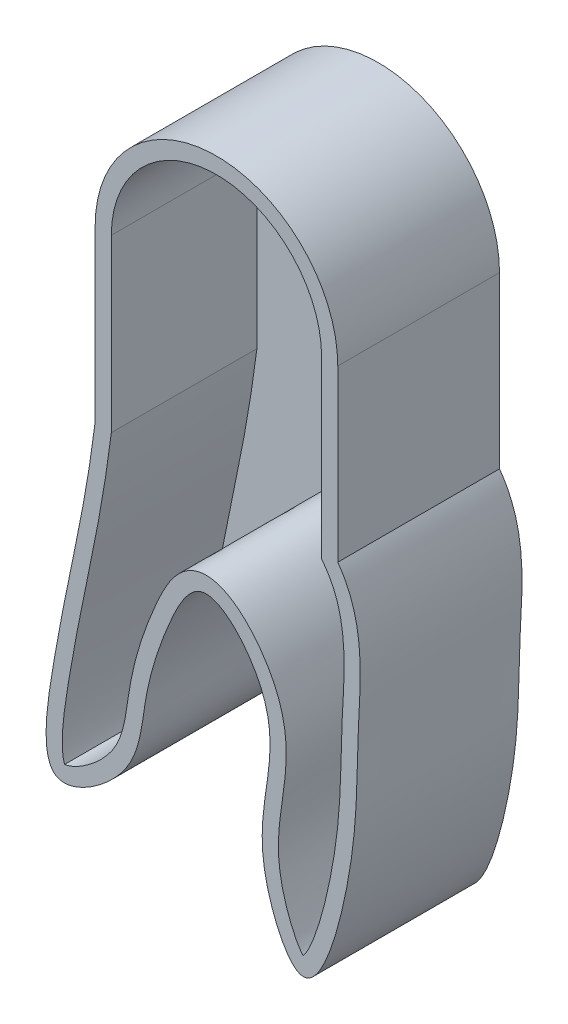
from build123d import *

# Parameters (mm, degrees)
EXTRUDE_1_DEPTH     = 10
SHELL_START         = 1
SHELL_1_DEPTH       = 9
SKETCH_2_R          = 2.5
CUT_EXTRUDE_1_DEPTH = 10


# Read off the part's stored shape, not the designer's step: 抽壳1
with BuildPart() as part:
    # 草图1 → 凸台-拉伸1 (new body)
    with BuildSketch(Plane.XY):
        with BuildLine():
            Line((7.5, 0), (7.5, -10.504729681))
            add(Edge.make_bspline(
                [(-7.5, -10.504729681), (-8.237692866, -16.341939492), (-9.423346825, -19.848680279), (-11.310421688, -32.767135896), (-4.816451011, -28.41808076), (-4.526845561, -23.67231359), (-3.413911229, -19.891624537), (-0.899508814, -14.646125223), (3.169720617, -19.182232615), (3.507472939, -23.903840986), (2.071045178, -28.290989918), (5.768685697, -36.949250656), (8.858203176, -25.581650207), (8.533740437, -19.156909422), (9.28913872, -12.950230698), (7.5, -10.504729681)],
                knots=[0, 0, 0, 0, 0.178620639, 0.24958107, 0.30893363, 0.361521367, 0.424026747, 0.465995345, 0.525846151, 0.56862507, 0.643666161, 0.705814194, 0.797942259, 0.893550311, 1, 1, 1, 1], degree=3))
            Line((-7.5, -10.504729681), (-7.5, 0))
            ThreePointArc((-7.5, 0), (0, 7.5), (7.5, 0))
        make_face()
    extrude(amount=EXTRUDE_1_DEPTH)

    # 抽壳1 outline → 抽壳1 (cut)
    with BuildSketch(Plane.XY.offset(SHELL_START)):
        with BuildLine():
            add(Edge.make_bspline(
                [(-9.383902892, -29.773691739), (-9.345005647, -29.770678871), (-9.294096014, -29.764011787), (-9.232413092, -29.75228086), (-9.161442536, -29.734674803), (-9.082569787, -29.710864184), (-8.996984959, -29.680774768), (-8.905709805, -29.644461518), (-8.80964954, -29.602073611), (-8.709620176, -29.553837703), (-8.606349618, -29.500018036), (-8.500481996, -29.440875358), (-8.392613639, -29.376679242), (-8.283339862, -29.307767597), (-8.037895571, -29.144369435), (-7.901279346, -29.047641155), (-7.764320472, -28.944820456), (-7.627938824, -28.836501751), (-7.493001987, -28.723294857), (-7.360340411, -28.605823618), (-7.230758927, -28.484727209), (-7.105044639, -28.360664102), (-6.983971186, -28.234318731), (-6.868299364, -28.106410797), (-6.758774133, -27.977707283), (-6.656117981, -27.849037118), (-6.561020663, -27.721308531), (-6.452401472, -27.564084202), (-6.431243879, -27.532839642), (-6.410089915, -27.500973477), (-6.390201162, -27.470364535), (-6.369240622, -27.437549386), (-6.350653598, -27.40766841), (-6.330273554, -27.374510326), (-6.312163421, -27.344160978), (-6.293091232, -27.311784606), (-6.275097209, -27.280452015), (-6.25715015, -27.248620075), (-6.239634779, -27.216875498), (-6.222435613, -27.185051245), (-6.188695791, -27.121296643), (-6.172153309, -27.089363709), (-6.155931658, -27.057371928), (-6.140024373, -27.025318155), (-6.124425119, -26.993199312), (-6.109127692, -26.961012393), (-6.094126017, -26.928754451), (-6.079414152, -26.896422619), (-6.064986284, -26.864014085), (-6.050836733, -26.831526116), (-6.036959947, -26.79895604), (-6.023350505, -26.766301256), (-6.01000312, -26.73355923), (-5.970731652, -26.635064025), (-5.945577899, -26.569042312), (-5.921409712, -26.502642812), (-5.898186907, -26.43584796), (-5.875870552, -26.36864211), (-5.854422748, -26.301011487), (-5.833806409, -26.232944124), (-5.813985034, -26.164429809), (-5.794922493, -26.095460032), (-5.776582804, -26.026027924), (-5.758929908, -25.956128206), (-5.741927452, -25.88575713), (-5.725538566, -25.814912427), (-5.693912717, -25.67227407), (-5.678675798, -25.600480123), (-5.663977649, -25.528210366), (-5.649780354, -25.455464859), (-5.636045251, -25.38224466), (-5.622732878, -25.308551707), (-5.60980291, -25.23438872), (-5.5972141, -25.15975908), (-5.584924221, -25.084666732), (-5.572890005, -25.009116066), (-5.561067085, -24.933111816), (-5.549409932, -24.856658944), (-5.537871799, -24.779762537), (-5.520671092, -24.663760272), (-5.514955281, -24.624983267), (-5.509251248, -24.586097337), (-5.503552931, -24.54710315), (-5.497854193, -24.508001381), (-5.492148815, -24.468792712), (-5.486430501, -24.429477833), (-5.480692873, -24.390057442), (-5.474929476, -24.350532245), (-5.469133775, -24.310902953), (-5.463299156, -24.27117029), (-5.457418926, -24.231334983), (-5.451486313, -24.191397769), (-5.44249854, -24.131340201), (-5.439487863, -24.111295711), (-5.436461547, -24.091226019), (-5.433418704, -24.071131224), (-5.43035845, -24.051011426), (-5.427279898, -24.030866722), (-5.424182162, -24.010697215), (-5.421064355, -23.990503), (-5.417925591, -23.970284179), (-5.414764985, -23.95004085), (-5.41158165, -23.929773112), (-5.408374699, -23.909481065), (-5.405143247, -23.889164808), (-5.398629567, -23.848484071), (-5.395345492, -23.828109009), (-5.392049369, -23.807798451), (-5.388728263, -23.78746793), (-5.385384599, -23.767133751), (-5.382022954, -23.746826151), (-5.378641774, -23.726535083), (-5.37523779, -23.706239326), (-5.371811713, -23.685943837), (-5.368366503, -23.66566832), (-5.364901329, -23.645407505), (-5.361412466, -23.625137129), (-5.357904059, -23.60488472), (-5.297895039, -23.260680114), (-5.235993395, -22.938607333), (-5.168419236, -22.617757174), (-5.094940308, -22.297484084), (-5.015339578, -21.977147889), (-4.929412628, -21.656104625), (-4.836964928, -21.333699118), (-4.737808968, -21.009259329), (-4.631761276, -20.682092469), (-4.518639292, -20.351482853), (-4.39825813, -20.016691539), (-4.270427199, -19.676957713), (-4.134946699, -19.331501836), (-3.982645074, -18.957532356), (-3.973654261, -18.935506089), (-3.964645341, -18.913482147), (-3.955538384, -18.891282487), (-3.946634022, -18.869581388), (-3.937114369, -18.846530764), (-3.928668233, -18.825973389), (-3.918580717, -18.801688835), (-3.910281691, -18.78158915), (-3.900379875, -18.757797004), (-3.891440241, -18.736314183), (-3.882060977, -18.713832222), (-3.872725684, -18.691505121), (-3.853948533, -18.64669963), (-3.844515734, -18.624242926), (-3.835038443, -18.601734185), (-3.825516394, -18.579175327), (-3.81594932, -18.556568275), (-3.806336953, -18.533914948), (-3.796679026, -18.511217269), (-3.786975272, -18.488477157), (-3.777225424, -18.465696536), (-3.767429215, -18.442877324), (-3.757586377, -18.420021445), (-3.747696644, -18.397130819), (-3.737759748, -18.374207367), (-3.707806769, -18.305344296), (-3.687647827, -18.259311449), (-3.66729615, -18.213169329), (-3.646749073, -18.166932613), (-3.626003711, -18.120615807), (-3.605056961, -18.074233236), (-3.583905503, -18.027799054), (-3.562545795, -17.981327229), (-3.540974079, -17.934831564), (-3.519186377, -17.888325675), (-3.497178492, -17.841823008), (-3.474946008, -17.795336828), (-3.452484292, -17.748880227), (-3.384396889, -17.6096379), (-3.338068252, -17.516980214), (-3.290762494, -17.424595066), (-3.242434456, -17.33258304), (-3.193033354, -17.241042282), (-3.142501947, -17.150067906), (-3.090775426, -17.059751792), (-3.037780044, -16.970182817), (-2.983431451, -16.881447473), (-2.927632778, -16.793630914), (-2.870272427, -16.706818402), (-2.811221599, -16.621097172), (-2.750331546, -16.536558699), (-2.624529543, -16.370044069), (-2.559618097, -16.288071928), (-2.492523903, -16.207475669), (-2.423052695, -16.128370792), (-2.350986672, -16.050886443), (-2.276081482, -15.975167102), (-2.198064208, -15.901383718), (-2.116634804, -15.829750926), (-2.031473402, -15.760546947), (-1.942255958, -15.694132813), (-1.848680637, -15.630967522), (-1.750507422, -15.57161575), (-1.647613345, -15.516744735), (-1.526622365, -15.46090224), (-1.513106192, -15.454779207), (-1.499517389, -15.448739326), (-1.485856107, -15.442784067), (-1.472122548, -15.436914909), (-1.458316959, -15.431133341), (-1.444439639, -15.425440857), (-1.430490933, -15.41983896), (-1.416471239, -15.414329161), (-1.402380999, -15.408912981), (-1.388220709, -15.403591944), (-1.373990908, -15.398367588), (-1.35969219, -15.393241455), (-1.338141696, -15.385701916), (-1.330941094, -15.38321368), (-1.323723488, -15.380750576), (-1.316488978, -15.378312794), (-1.309237665, -15.375900523), (-1.301969648, -15.373513955), (-1.294685029, -15.371153276), (-1.287383906, -15.368818678), (-1.28006638, -15.36651035), (-1.272732552, -15.364228482), (-1.265382522, -15.361973262), (-1.25801639, -15.359744882), (-1.250634255, -15.357543529), (-1.235838183, -15.35319526), (-1.228425099, -15.351048626), (-1.221000436, -15.348930241), (-1.213523977, -15.346829838), (-1.206090361, -15.344773553), (-1.19866789, -15.342752119), (-1.191202271, -15.340750402), (-1.18372649, -15.338777744), (-1.176282499, -15.336845772), (-1.168831324, -15.334943362), (-1.161340716, -15.333061464), (-1.153884058, -15.331220661), (-1.146408026, -15.329405813), (-1.109028632, -15.320488565), (-1.079080142, -15.313844249), (-1.049099169, -15.307687187), (-1.019097784, -15.302014682), (-0.989087634, -15.296823567), (-0.959079945, -15.292110202), (-0.92908552, -15.287870481), (-0.899114742, -15.284099825), (-0.869177571, -15.280793189), (-0.839283544, -15.277945054), (-0.809441777, -15.275549434), (-0.779660965, -15.273599871), (-0.749949379, -15.272089438), (-0.661045852, -15.26885334), (-0.60208361, -15.268424744), (-0.543489175, -15.26966956), (-0.4853144, -15.272528342), (-0.427602375, -15.276939146), (-0.370387898, -15.282838886), (-0.313698015, -15.290164505), (-0.257552629, -15.298853954), (-0.201965177, -15.308846976), (-0.14694337, -15.320085705), (-0.092490005, -15.33251507), (-0.038603842, -15.34608301), (0.014719454, -15.360740494), (0.278553682, -15.439244799), (0.480721416, -15.518747802), (0.674426214, -15.611979803), (0.860789169, -15.716826221), (1.04090182, -15.831865529), (1.215602521, -15.956115143), (1.385473291, -16.08881583), (1.550899578, -16.229303334), (1.712120427, -16.376960115), (1.869254299, -16.531209674), (2.022316338, -16.691510693), (2.171246133, -16.85732829), (2.315941082, -17.028105047), (2.526388235, -17.290935039), (2.595438628, -17.379654904), (2.663370193, -17.469418973), (2.730160357, -17.560161705), (2.795784301, -17.651817857), (2.860215121, -17.744322665), (2.923423982, -17.837612021), (2.985380283, -17.931622656), (3.046051809, -18.02629231), (3.10540489, -18.121559921), (3.163404567, -18.217365798), (3.220014738, -18.313651799), (3.275198329, -18.410361514), (3.355776998, -18.555979899), (3.382273154, -18.604618526), (3.40837042, -18.653275177), (3.43423063, -18.702346213), (3.459259036, -18.75040377), (3.484958985, -18.801064441), (3.508389778, -18.847298414), (3.534016121, -18.899747384), (3.55643196, -18.945606725), (3.58082973, -18.997113259), (3.603248377, -19.045017187), (3.626001781, -19.09467686), (3.648111033, -19.143878136), (3.691455376, -19.242264306), (3.712673027, -19.291411264), (3.733438937, -19.340510956), (3.753755939, -19.389562204), (3.773626916, -19.438563791), (3.793054807, -19.487514459), (3.812042602, -19.53641291), (3.830593344, -19.585257805), (3.848710128, -19.634047769), (3.866396102, -19.682781382), (3.883654467, -19.731457187), (3.900488477, -19.780073688), (3.916901438, -19.828629345), (3.996877791, -20.071095533), (4.054177293, -20.264069894), (4.10500908, -20.45594835), (4.149605674, -20.646626058), (4.188217429, -20.835996471), (4.221111375, -21.023956282), (4.248569687, -21.210409476), (4.270887814, -21.395270501), (4.288372248, -21.578466548), (4.301337937, -21.759938954), (4.310105347, -21.939643705), (4.314997169, -22.117551066), (4.316334669, -22.293644318), (4.31395844, -22.511485935), (4.313280843, -22.554940492), (4.312405883, -22.598281211), (4.311338533, -22.641508056), (4.310083747, -22.68462103), (4.308646464, -22.727620166), (4.307031601, -22.77050554), (4.305244062, -22.813277259), (4.30328873, -22.855935468), (4.301170472, -22.898480348), (4.298894138, -22.940912114), (4.296464558, -22.98323102), (4.293886547, -23.025437354), (4.288443255, -23.109625528), (4.285577681, -23.151613067), (4.282571988, -23.19350066), (4.279430271, -23.235289907), (4.276156715, -23.276980641), (4.272755489, -23.318572767), (4.269230695, -23.360067016), (4.265586373, -23.401464931), (4.261826522, -23.442768408), (4.257955139, -23.483979085), (4.253976242, -23.525097922), (4.249893864, -23.566125264), (4.245712004, -23.607061712), (4.232879503, -23.729606913), (4.223942015, -23.81094887), (4.214653615, -23.891946405), (4.205045453, -23.972610191), (4.195148263, -24.052951143), (4.184992354, -24.132980427), (4.174607617, -24.212709451), (4.164023521, -24.292149874), (4.153269116, -24.371313598), (4.142373028, -24.450212774), (4.131363466, -24.528859797), (4.120268216, -24.607267311), (4.109114642, -24.685448206), (4.07555979, -24.919350439), (4.053063483, -25.074429687), (4.030657439, -25.228757936), (4.008550654, -25.38244116), (3.986945063, -25.535587143), (3.966036149, -25.688305874), (3.946013552, -25.840709964), (3.927061676, -25.992915033), (3.909360301, -26.145040137), (3.893085189, -26.297208148), (3.878408695, -26.449546178), (3.865500373, -26.602185969), (3.85452759, -26.75526431), (3.841220398, -26.98575299), (3.837310611, -27.062727711), (3.833947262, -27.139865492), (3.831151, -27.217184551), (3.828942624, -27.294703423), (3.827343088, -27.372440967), (3.826373496, -27.450416352), (3.826055107, -27.528649076), (3.826409331, -27.607158945), (3.827457731, -27.685966093), (3.829222023, -27.765090968), (3.831724076, -27.844554337), (3.834985909, -27.924377287), (3.841051592, -28.04468319), (3.843269079, -28.084880349), (3.845684971, -28.125175364), (3.848302103, -28.165570907), (3.851123336, -28.20606966), (3.854151551, -28.246674308), (3.857389656, -28.287387552), (3.86084058, -28.328212089), (3.864507276, -28.369150636), (3.868392721, -28.410205909), (3.872499917, -28.451380637), (3.876831886, -28.492677552), (3.881391678, -28.534099399), (3.888577704, -28.596423691), (3.891030753, -28.617230373), (3.893541903, -28.638069315), (3.896111546, -28.658940858), (3.898740077, -28.679845344), (3.901427889, -28.700783115), (3.904175376, -28.721754513), (3.906982932, -28.74275988), (3.909850949, -28.763799557), (3.912779822, -28.784873886), (3.915769945, -28.80598321), (3.91882171, -28.827127869), (3.921935513, -28.848308206), (3.926699861, -28.880132741), (3.928303429, -28.890748928), (3.929923068, -28.901376692), (3.931558299, -28.912012807), (3.93320897, -28.922656055), (3.934875393, -28.933308079), (3.936557956, -28.943971002), (3.938256738, -28.954645082), (3.939971448, -28.965328251), (3.941701718, -28.976017961), (3.943447624, -28.986714332), (3.94521, -28.997422183), (3.946989934, -29.008148087), (3.950583213, -29.029626252), (3.952396686, -29.040379176), (3.95422695, -29.051145736), (3.956073966, -29.061925726), (3.95793769, -29.072718939), (3.959818082, -29.083525173), (3.9617151, -29.094344216), (3.963628704, -29.105175869), (3.96555885, -29.116019919), (3.967505499, -29.126876167), (3.969468609, -29.137744402), (3.971448138, -29.148624421), (3.973444045, -29.159516017), (4.029286948, -29.462090457), (4.094812958, -29.761892106), (4.171150432, -30.066043691), (4.257616808, -30.370429812), (4.352383063, -30.672796645), (4.455958451, -30.967269775), (4.564783912, -31.253538902), (4.680226459, -31.525039049), (4.798573494, -31.780030615), (4.919618405, -32.014002954), (5.040344685, -32.222638391), (5.158197605, -32.401754714), (5.268078386, -32.545190623), (5.359542659, -32.64866917)],
                knots=[0.257794506, 0.257794506, 0.257794506, 0.257794506, 0.257794506, 0.257794506, 0.257794506, 0.257794506, 0.257794506, 0.257794506, 0.257794506, 0.257794506, 0.257794506, 0.257794506, 0.257794506, 0.28066204, 0.28066204, 0.28066204, 0.28066204, 0.28066204, 0.28066204, 0.28066204, 0.28066204, 0.28066204, 0.28066204, 0.28066204, 0.28066204, 0.28066204, 0.308744227, 0.308744227, 0.308744227, 0.308744227, 0.308744227, 0.308744227, 0.308744227, 0.308744227, 0.308744227, 0.308744227, 0.308744227, 0.308744227, 0.308744227, 0.315764774, 0.315764774, 0.315764774, 0.315764774, 0.315764774, 0.315764774, 0.315764774, 0.315764774, 0.315764774, 0.315764774, 0.315764774, 0.315764774, 0.315764774, 0.322785321, 0.322785321, 0.322785321, 0.322785321, 0.322785321, 0.322785321, 0.322785321, 0.322785321, 0.322785321, 0.322785321, 0.322785321, 0.322785321, 0.322785321, 0.336826415, 0.336826415, 0.336826415, 0.336826415, 0.336826415, 0.336826415, 0.336826415, 0.336826415, 0.336826415, 0.336826415, 0.336826415, 0.336826415, 0.336826415, 0.350867509, 0.350867509, 0.350867509, 0.350867509, 0.350867509, 0.350867509, 0.350867509, 0.350867509, 0.350867509, 0.350867509, 0.350867509, 0.350867509, 0.350867509, 0.357888056, 0.357888056, 0.357888056, 0.357888056, 0.357888056, 0.357888056, 0.357888056, 0.357888056, 0.357888056, 0.357888056, 0.357888056, 0.357888056, 0.357888056, 0.361398329, 0.361398329, 0.361398329, 0.361398329, 0.361398329, 0.361398329, 0.361398329, 0.361398329, 0.361398329, 0.361398329, 0.361398329, 0.361398329, 0.361398329, 0.364908602, 0.364908602, 0.364908602, 0.364908602, 0.364908602, 0.364908602, 0.364908602, 0.364908602, 0.364908602, 0.364908602, 0.364908602, 0.364908602, 0.364908602, 0.421072977, 0.421072977, 0.421072977, 0.421072977, 0.421072977, 0.421072977, 0.421072977, 0.421072977, 0.421072977, 0.421072977, 0.421072977, 0.421072977, 0.421072977, 0.424583251, 0.424583251, 0.424583251, 0.424583251, 0.424583251, 0.424583251, 0.424583251, 0.424583251, 0.424583251, 0.424583251, 0.424583251, 0.424583251, 0.424583251, 0.428093524, 0.428093524, 0.428093524, 0.428093524, 0.428093524, 0.428093524, 0.428093524, 0.428093524, 0.428093524, 0.428093524, 0.428093524, 0.428093524, 0.428093524, 0.435114071, 0.435114071, 0.435114071, 0.435114071, 0.435114071, 0.435114071, 0.435114071, 0.435114071, 0.435114071, 0.435114071, 0.435114071, 0.435114071, 0.435114071, 0.449155165, 0.449155165, 0.449155165, 0.449155165, 0.449155165, 0.449155165, 0.449155165, 0.449155165, 0.449155165, 0.449155165, 0.449155165, 0.449155165, 0.449155165, 0.463196259, 0.463196259, 0.463196259, 0.463196259, 0.463196259, 0.463196259, 0.463196259, 0.463196259, 0.463196259, 0.463196259, 0.463196259, 0.463196259, 0.463196259, 0.464951395, 0.464951395, 0.464951395, 0.464951395, 0.464951395, 0.464951395, 0.464951395, 0.464951395, 0.464951395, 0.464951395, 0.464951395, 0.464951395, 0.464951395, 0.465828964, 0.465828964, 0.465828964, 0.465828964, 0.465828964, 0.465828964, 0.465828964, 0.465828964, 0.465828964, 0.465828964, 0.465828964, 0.465828964, 0.465828964, 0.466706532, 0.466706532, 0.466706532, 0.466706532, 0.466706532, 0.466706532, 0.466706532, 0.466706532, 0.466706532, 0.466706532, 0.466706532, 0.466706532, 0.466706532, 0.470216805, 0.470216805, 0.470216805, 0.470216805, 0.470216805, 0.470216805, 0.470216805, 0.470216805, 0.470216805, 0.470216805, 0.470216805, 0.470216805, 0.470216805, 0.477237352, 0.477237352, 0.477237352, 0.477237352, 0.477237352, 0.477237352, 0.477237352, 0.477237352, 0.477237352, 0.477237352, 0.477237352, 0.477237352, 0.477237352, 0.50531954, 0.50531954, 0.50531954, 0.50531954, 0.50531954, 0.50531954, 0.50531954, 0.50531954, 0.50531954, 0.50531954, 0.50531954, 0.50531954, 0.50531954, 0.519360633, 0.519360633, 0.519360633, 0.519360633, 0.519360633, 0.519360633, 0.519360633, 0.519360633, 0.519360633, 0.519360633, 0.519360633, 0.519360633, 0.519360633, 0.52638118, 0.52638118, 0.52638118, 0.52638118, 0.52638118, 0.52638118, 0.52638118, 0.52638118, 0.52638118, 0.52638118, 0.52638118, 0.52638118, 0.52638118, 0.533401727, 0.533401727, 0.533401727, 0.533401727, 0.533401727, 0.533401727, 0.533401727, 0.533401727, 0.533401727, 0.533401727, 0.533401727, 0.533401727, 0.533401727, 0.561483915, 0.561483915, 0.561483915, 0.561483915, 0.561483915, 0.561483915, 0.561483915, 0.561483915, 0.561483915, 0.561483915, 0.561483915, 0.561483915, 0.561483915, 0.568504462, 0.568504462, 0.568504462, 0.568504462, 0.568504462, 0.568504462, 0.568504462, 0.568504462, 0.568504462, 0.568504462, 0.568504462, 0.568504462, 0.568504462, 0.575525008, 0.575525008, 0.575525008, 0.575525008, 0.575525008, 0.575525008, 0.575525008, 0.575525008, 0.575525008, 0.575525008, 0.575525008, 0.575525008, 0.575525008, 0.589566102, 0.589566102, 0.589566102, 0.589566102, 0.589566102, 0.589566102, 0.589566102, 0.589566102, 0.589566102, 0.589566102, 0.589566102, 0.589566102, 0.589566102, 0.61764829, 0.61764829, 0.61764829, 0.61764829, 0.61764829, 0.61764829, 0.61764829, 0.61764829, 0.61764829, 0.61764829, 0.61764829, 0.61764829, 0.61764829, 0.631689383, 0.631689383, 0.631689383, 0.631689383, 0.631689383, 0.631689383, 0.631689383, 0.631689383, 0.631689383, 0.631689383, 0.631689383, 0.631689383, 0.631689383, 0.63870993, 0.63870993, 0.63870993, 0.63870993, 0.63870993, 0.63870993, 0.63870993, 0.63870993, 0.63870993, 0.63870993, 0.63870993, 0.63870993, 0.63870993, 0.642220204, 0.642220204, 0.642220204, 0.642220204, 0.642220204, 0.642220204, 0.642220204, 0.642220204, 0.642220204, 0.642220204, 0.642220204, 0.642220204, 0.642220204, 0.64397534, 0.64397534, 0.64397534, 0.64397534, 0.64397534, 0.64397534, 0.64397534, 0.64397534, 0.64397534, 0.64397534, 0.64397534, 0.64397534, 0.64397534, 0.645730477, 0.645730477, 0.645730477, 0.645730477, 0.645730477, 0.645730477, 0.645730477, 0.645730477, 0.645730477, 0.645730477, 0.645730477, 0.645730477, 0.645730477, 0.692683134, 0.692683134, 0.692683134, 0.692683134, 0.692683134, 0.692683134, 0.692683134, 0.692683134, 0.692683134, 0.692683134, 0.692683134, 0.692683134, 0.692683134, 0.692683134, 0.692683134], degree=14))
            add(Edge.make_bspline(
                [(5.359542659, -32.64866917), (5.407608138, -32.588791603), (5.461304538, -32.515305432), (5.51883647, -32.428836778), (5.578926432, -32.330279202), (5.640708122, -32.220515361), (5.703542867, -32.100362423), (5.766959639, -31.970611765), (5.830609205, -31.831996661), (5.894207501, -31.685161828), (5.957521534, -31.530737978), (6.020383988, -31.369395255), (6.082632778, -31.201654408), (6.228821196, -30.789196527), (6.312098293, -30.539272307), (6.393644046, -30.279801948), (6.473205228, -30.012180284), (6.550579645, -29.737749422), (6.625597621, -29.457813672), (6.69811004, -29.173650301), (6.767981385, -28.886517044), (6.835086256, -28.597657315), (6.899307813, -28.308304077), (6.96053662, -28.019683288), (7.018668333, -27.733017892), (7.08733132, -27.378662134), (7.100864106, -27.307988376), (7.114194547, -27.237536715), (7.127322183, -27.167319599), (7.14024552, -27.097355709), (7.152962261, -27.027668599), (7.165470452, -26.958279853), (7.177769063, -26.889205646), (7.189857443, -26.820459979), (7.20173403, -26.752062357), (7.213395631, -26.684042088), (7.22483951, -26.616425848), (7.247303435, -26.481953371), (7.258323039, -26.415099999), (7.269132827, -26.348624661), (7.279735345, -26.282522524), (7.290133137, -26.216788755), (7.300328748, -26.151418521), (7.310324721, -26.086406988), (7.320123602, -26.021749324), (7.329727933, -25.957440695), (7.339140261, -25.89347627), (7.348363129, -25.829851214), (7.357399082, -25.766560694), (7.383953827, -25.577678245), (7.400919376, -25.453075104), (7.417167574, -25.329751213), (7.43271861, -25.207667202), (7.447592601, -25.086783564), (7.461809592, -24.967060662), (7.475389552, -24.848458723), (7.48835238, -24.730937845), (7.5007179, -24.614457989), (7.512505864, -24.498978986), (7.52373595, -24.384460532), (7.534427763, -24.27086219), (7.564946983, -23.932705796), (7.5832179, -23.71078701), (7.599570146, -23.492063515), (7.614158646, -23.276210943), (7.62713702, -23.062904918), (7.638657913, -22.851821877), (7.648873321, -22.642639911), (7.65793492, -22.435039592), (7.665994398, -22.228704807), (7.67320378, -22.023323589), (7.679715758, -21.818588946), (7.685684019, -21.614199701), (7.694053355, -21.30769212), (7.696745979, -21.205535559), (7.699360821, -21.103354716), (7.701917347, -21.001113064), (7.704435113, -20.898774467), (7.706933766, -20.796303173), (7.709433047, -20.693663821), (7.711952787, -20.590821439), (7.714512908, -20.487741441), (7.717133425, -20.38438963), (7.719834443, -20.280732197), (7.722636159, -20.176735721), (7.727020214, -20.020182896), (7.728511775, -19.967905408), (7.730036099, -19.915530677), (7.731595738, -19.863054673), (7.733193246, -19.810473366), (7.734831176, -19.757782727), (7.736512081, -19.704978725), (7.738238514, -19.652057332), (7.740013028, -19.599014516), (7.741838177, -19.545846249), (7.743716512, -19.492548499), (7.745650589, -19.439117239), (7.748639144, -19.358764036), (7.749649909, -19.331945285), (7.750675575, -19.305091697), (7.751716464, -19.278202785), (7.752772897, -19.251278062), (7.753845195, -19.224317041), (7.75493368, -19.197319235), (7.756038673, -19.170284158), (7.757160496, -19.143211321), (7.758299469, -19.116100238), (7.759455915, -19.088950422), (7.760630155, -19.061761386), (7.762418687, -19.020918271), (7.763019256, -19.007296367), (7.763624962, -18.993654097), (7.764234562, -18.980015902), (7.764848666, -18.966369105), (7.765468171, -18.952697614), (7.766092849, -18.939009094), (7.76672169, -18.925324854), (7.767354195, -18.911652009), (7.767990935, -18.897973991), (7.76863241, -18.884278467), (7.769277511, -18.870590919), (7.77057583, -18.843204597), (7.771228954, -18.829508423), (7.771885959, -18.815809265), (7.772546764, -18.802107156), (7.773211285, -18.788402122), (7.773879441, -18.774694197), (7.774551149, -18.760983407), (7.775226328, -18.747269785), (7.775904895, -18.73355336), (7.776586768, -18.719834162), (7.777271863, -18.70611222), (7.777960101, -18.692387565), (7.789712134, -18.459022813), (7.801554983, -18.23869892), (7.813847638, -18.017814374), (7.826262881, -17.796505224), (7.838478649, -17.574916962), (7.850178108, -17.353203735), (7.861049728, -17.131527565), (7.870787343, -16.910057563), (7.879090235, -16.688969148), (7.885663195, -16.468443259), (7.890216601, -16.248665577), (7.892466482, -16.029825738), (7.891802711, -15.594407362), (7.888889541, -15.377828595), (7.883119947, -15.162572412), (7.874224196, -14.948833451), (7.861940059, -14.736807653), (7.846014297, -14.5266906), (7.826203539, -14.318675369), (7.802274547, -14.112949904), (7.774003865, -13.909693897), (7.741176866, -13.709075191), (7.703586173, -13.511245694), (7.661029485, -13.316336804), (7.58944542, -13.028513137), (7.564292479, -12.933328412), (7.537822608, -12.838913789), (7.510010603, -12.745281111), (7.480831183, -12.652440445), (7.450258758, -12.560400079), (7.418267205, -12.469166506), (7.384829644, -12.378744415), (7.349918206, -12.289136684), (7.313503812, -12.200344365), (7.275555947, -12.112366679), (7.23604243, -12.025201), (7.17437257, -11.895663779), (7.153415963, -11.852686705), (7.13205515, -11.809911046), (7.110285766, -11.767336155), (7.088103296, -11.724961321), (7.06550308, -11.682785773), (7.042480307, -11.640808676), (7.019030021, -11.599029136), (6.995147116, -11.557446194), (6.97082634, -11.51605883), (6.946062292, -11.474865961), (6.920849424, -11.433866444), (6.882348347, -11.372655387), (6.869401111, -11.352299754), (6.856339563, -11.331992035), (6.843162935, -11.311732086), (6.829870457, -11.291519767), (6.816461362, -11.271354936), (6.802934881, -11.251237453), (6.789290246, -11.231167176), (6.775526688, -11.211143963), (6.761643438, -11.191167673), (6.747639729, -11.171238165), (6.733514791, -11.151355298), (6.71748699, -11.129039385), (6.715704215, -11.126560565), (6.713919531, -11.124082472), (6.712132937, -11.121605106), (6.71034443, -11.119128465), (6.708554009, -11.11665255), (6.706761672, -11.114177359), (6.704967417, -11.111702895), (6.703171244, -11.109229155), (6.70137315, -11.106756139), (6.699573134, -11.104283848), (6.697771195, -11.101812281), (6.695741846, -11.099032582), (6.695516333, -11.098723738), (6.69529079, -11.098414905), (6.695065216, -11.098106084), (6.694839613, -11.097797274), (6.694613979, -11.097488474), (6.694388315, -11.097179687), (6.694162621, -11.096870911), (6.693936898, -11.096562146), (6.693711144, -11.096253392), (6.693485359, -11.09594465), (6.693259545, -11.095635919), (6.693033701, -11.095327199), (6.693019586, -11.095307904), (6.693002103, -11.095284006), (6.693016079, -11.095303109), (6.692886491, -11.095125979), (6.693172434, -11.095516825), (6.692626058, -11.094770002), (6.69326658, -11.095645506), (6.692706755, -11.094880309), (6.692989814, -11.095267205), (6.692862995, -11.095093864), (6.692871116, -11.095104963), (6.692851471, -11.095078111), (6.69281772, -11.095031978), (6.692800844, -11.095008912), (6.692783969, -11.094985846), (6.692767094, -11.09496278), (6.692750218, -11.094939713), (6.692733343, -11.094916647), (6.692716468, -11.094893581), (6.692699592, -11.094870515), (6.692682717, -11.094847449), (6.692665842, -11.094824382), (6.692648966, -11.094801316), (6.692632091, -11.09477825), (6.692581465, -11.094709051), (6.692547714, -11.094662919), (6.692513964, -11.094616786), (6.692480213, -11.094570654), (6.692446462, -11.094524521), (6.692412711, -11.094478389), (6.692378961, -11.094432257), (6.69234521, -11.094386124), (6.692311459, -11.094339992), (6.692277709, -11.094293859), (6.692243958, -11.094247727), (6.692210207, -11.094201594), (6.692176457, -11.094155462), (6.692108955, -11.094063197), (6.692041454, -11.093970932), (6.691973952, -11.093878667), (6.691906451, -11.093786402), (6.69183895, -11.093694137), (6.691771448, -11.093601872), (6.691703947, -11.093509607), (6.691636445, -11.093417342), (6.691568944, -11.093325078), (6.691501443, -11.093232813), (6.691433941, -11.093140548), (6.69136644, -11.093048283), (6.691163936, -11.092771488), (6.691028933, -11.092586958), (6.69089393, -11.092402428), (6.690758927, -11.092217899), (6.690623925, -11.092033369), (6.690488922, -11.091848839), (6.690353919, -11.091664309), (6.690218916, -11.091479779), (6.690083914, -11.09129525), (6.689948911, -11.09111072), (6.689813908, -11.09092619), (6.689678905, -11.09074166), (6.689003891, -11.089819011), (6.68846388, -11.089080892), (6.687923869, -11.088342773), (6.687383858, -11.087604653), (6.686843847, -11.086866534), (6.686303836, -11.086128415), (6.685763825, -11.085390295), (6.685223813, -11.084652176), (6.684683802, -11.083914057), (6.684143791, -11.083175938), (6.68360378, -11.082437819), (6.683063769, -11.081699699), (6.681443736, -11.079485341), (6.680363713, -11.078009103), (6.679283691, -11.076532864), (6.678203669, -11.075056626), (6.677123647, -11.073580387), (6.676043624, -11.072104149), (6.674963602, -11.07062791), (6.67388358, -11.069151672), (6.672803558, -11.067675433), (6.671723536, -11.066199195), (6.670643513, -11.064722956), (6.669563491, -11.063246718), (6.66416338, -11.055865525), (6.659843291, -11.049960571), (6.655523202, -11.044055617), (6.651203113, -11.038150663), (6.646883024, -11.032245709), (6.642562935, -11.026340755), (6.638242846, -11.020435801), (6.633922757, -11.014530847), (6.629602668, -11.008625893), (6.625282579, -11.002720939), (6.62096249, -10.996815985), (6.616642401, -10.990911031), (6.603682135, -10.973196169), (6.595041957, -10.961386261), (6.586401779, -10.949576353), (6.577761601, -10.937766445), (6.569121423, -10.925956537), (6.560481245, -10.914146628), (6.551841067, -10.902336721), (6.543200889, -10.890526812), (6.534560712, -10.878716904), (6.525920534, -10.866906996), (6.517280356, -10.855097088), (6.508640178, -10.84328718), (6.5, -10.831477272)],
                knots=[0.728439567, 0.728439567, 0.728439567, 0.728439567, 0.728439567, 0.728439567, 0.728439567, 0.728439567, 0.728439567, 0.728439567, 0.728439567, 0.728439567, 0.728439567, 0.728439567, 0.754330529, 0.754330529, 0.754330529, 0.754330529, 0.754330529, 0.754330529, 0.754330529, 0.754330529, 0.754330529, 0.754330529, 0.754330529, 0.754330529, 0.789972782, 0.789972782, 0.789972782, 0.789972782, 0.789972782, 0.789972782, 0.789972782, 0.789972782, 0.789972782, 0.789972782, 0.789972782, 0.789972782, 0.798883345, 0.798883345, 0.798883345, 0.798883345, 0.798883345, 0.798883345, 0.798883345, 0.798883345, 0.798883345, 0.798883345, 0.798883345, 0.798883345, 0.807793908, 0.807793908, 0.807793908, 0.807793908, 0.807793908, 0.807793908, 0.807793908, 0.807793908, 0.807793908, 0.807793908, 0.807793908, 0.807793908, 0.825615034, 0.825615034, 0.825615034, 0.825615034, 0.825615034, 0.825615034, 0.825615034, 0.825615034, 0.825615034, 0.825615034, 0.825615034, 0.825615034, 0.861257287, 0.861257287, 0.861257287, 0.861257287, 0.861257287, 0.861257287, 0.861257287, 0.861257287, 0.861257287, 0.861257287, 0.861257287, 0.861257287, 0.879078414, 0.879078414, 0.879078414, 0.879078414, 0.879078414, 0.879078414, 0.879078414, 0.879078414, 0.879078414, 0.879078414, 0.879078414, 0.879078414, 0.887988977, 0.887988977, 0.887988977, 0.887988977, 0.887988977, 0.887988977, 0.887988977, 0.887988977, 0.887988977, 0.887988977, 0.887988977, 0.887988977, 0.892444259, 0.892444259, 0.892444259, 0.892444259, 0.892444259, 0.892444259, 0.892444259, 0.892444259, 0.892444259, 0.892444259, 0.892444259, 0.892444259, 0.894671899, 0.894671899, 0.894671899, 0.894671899, 0.894671899, 0.894671899, 0.894671899, 0.894671899, 0.894671899, 0.894671899, 0.894671899, 0.894671899, 0.89689954, 0.89689954, 0.89689954, 0.89689954, 0.89689954, 0.89689954, 0.89689954, 0.89689954, 0.89689954, 0.89689954, 0.89689954, 0.89689954, 0.932541793, 0.932541793, 0.932541793, 0.932541793, 0.932541793, 0.932541793, 0.932541793, 0.932541793, 0.932541793, 0.932541793, 0.932541793, 0.932541793, 0.968184046, 0.968184046, 0.968184046, 0.968184046, 0.968184046, 0.968184046, 0.968184046, 0.968184046, 0.968184046, 0.968184046, 0.968184046, 0.968184046, 0.986005172, 0.986005172, 0.986005172, 0.986005172, 0.986005172, 0.986005172, 0.986005172, 0.986005172, 0.986005172, 0.986005172, 0.986005172, 0.986005172, 0.994915736, 0.994915736, 0.994915736, 0.994915736, 0.994915736, 0.994915736, 0.994915736, 0.994915736, 0.994915736, 0.994915736, 0.994915736, 0.994915736, 0.999371017, 0.999371017, 0.999371017, 0.999371017, 0.999371017, 0.999371017, 0.999371017, 0.999371017, 0.999371017, 0.999371017, 0.999371017, 0.999371017, 0.999927928, 0.999927928, 0.999927928, 0.999927928, 0.999927928, 0.999927928, 0.999927928, 0.999927928, 0.999927928, 0.999927928, 0.999927928, 0.999927928, 0.999997541, 0.999997541, 0.999997541, 0.999997541, 0.999997541, 0.999997541, 0.999997541, 0.999997541, 0.999997541, 0.999997541, 0.999997541, 0.999997541, 0.999997541, 1.000001892, 1.000001892, 1.000001892, 1.000001892, 1.000001892, 1.000001892, 1.000001892, 1.000001892, 1.000001892, 1.000001892, 1.000001892, 1.000001892, 1.000006243, 1.000006243, 1.000006243, 1.000006243, 1.000006243, 1.000006243, 1.000006243, 1.000006243, 1.000006243, 1.000006243, 1.000006243, 1.000006243, 1.000014945, 1.000014945, 1.000014945, 1.000014945, 1.000014945, 1.000014945, 1.000014945, 1.000014945, 1.000014945, 1.000014945, 1.000014945, 1.000014945, 1.000014945, 1.000032348, 1.000032348, 1.000032348, 1.000032348, 1.000032348, 1.000032348, 1.000032348, 1.000032348, 1.000032348, 1.000032348, 1.000032348, 1.000032348, 1.000067155, 1.000067155, 1.000067155, 1.000067155, 1.000067155, 1.000067155, 1.000067155, 1.000067155, 1.000067155, 1.000067155, 1.000067155, 1.000067155, 1.000206383, 1.000206383, 1.000206383, 1.000206383, 1.000206383, 1.000206383, 1.000206383, 1.000206383, 1.000206383, 1.000206383, 1.000206383, 1.000206383, 1.000484838, 1.000484838, 1.000484838, 1.000484838, 1.000484838, 1.000484838, 1.000484838, 1.000484838, 1.000484838, 1.000484838, 1.000484838, 1.000484838, 1.001598658, 1.001598658, 1.001598658, 1.001598658, 1.001598658, 1.001598658, 1.001598658, 1.001598658, 1.001598658, 1.001598658, 1.001598658, 1.001598658, 1.003826299, 1.003826299, 1.003826299, 1.003826299, 1.003826299, 1.003826299, 1.003826299, 1.003826299, 1.003826299, 1.003826299, 1.003826299, 1.003826299, 1.003826299, 1.003826299], degree=13))
            Line((6.5, -10.831477272), (6.5, 0))
            ThreePointArc((6.5, 0), (0, 6.5), (-6.5, 0))
            Line((-6.5, 0), (-6.5, -10.567668199))
            add(Edge.make_bspline(
                [(-6.5, -10.567668199), (-6.500113455, -10.568565941), (-6.500226909, -10.569463683), (-6.500340364, -10.570361425), (-6.500453818, -10.571259167), (-6.500567273, -10.572156908), (-6.500680727, -10.57305465), (-6.500794182, -10.573952392), (-6.500907636, -10.574850134), (-6.501021091, -10.575747876), (-6.501134545, -10.576645618), (-6.501248, -10.57754336), (-6.501361454, -10.578441101), (-6.501474909, -10.579338843), (-6.50200939, -10.58356808), (-6.502430416, -10.586899575), (-6.502851443, -10.59023107), (-6.503272469, -10.593562565), (-6.503693496, -10.59689406), (-6.504114522, -10.600225555), (-6.504535549, -10.603557049), (-6.504956575, -10.606888545), (-6.505377602, -10.610220039), (-6.505798628, -10.613551534), (-6.506219655, -10.616883029), (-6.506640681, -10.620214524), (-6.507061708, -10.623546019), (-6.507535362, -10.627293951), (-6.50758776, -10.627708568), (-6.50764165, -10.628134959), (-6.50769155, -10.628529859), (-6.507746246, -10.628962643), (-6.507800619, -10.629392838), (-6.507850051, -10.629783998), (-6.50790094, -10.630186728), (-6.507957623, -10.630635247), (-6.508012474, -10.631069215), (-6.508061539, -10.631457416), (-6.508117031, -10.631896457), (-6.508169706, -10.632313189), (-6.508276036, -10.633154379), (-6.508329202, -10.633574962), (-6.508382368, -10.633995533), (-6.508435534, -10.634416091), (-6.508488702, -10.634836638), (-6.508541868, -10.635257172), (-6.508595037, -10.635677695), (-6.508648204, -10.636098204), (-6.508701373, -10.636518703), (-6.508754542, -10.636939189), (-6.508807712, -10.637359663), (-6.508860882, -10.637780125), (-6.508914052, -10.638200575), (-6.509073564, -10.639461889), (-6.509179908, -10.640302716), (-6.509286253, -10.641143495), (-6.5093926, -10.641984226), (-6.509498948, -10.642824909), (-6.509605298, -10.643665543), (-6.50971165, -10.644506129), (-6.509818004, -10.645346667), (-6.50992436, -10.646187156), (-6.510030717, -10.647027598), (-6.510137076, -10.647867991), (-6.510243437, -10.648708335), (-6.510349799, -10.649548632), (-6.510668892, -10.652069377), (-6.510881627, -10.653749681), (-6.511094369, -10.655429792), (-6.511307118, -10.65710971), (-6.511519874, -10.658789436), (-6.511732638, -10.660468969), (-6.511945408, -10.662148308), (-6.512158185, -10.663827456), (-6.512370969, -10.665506411), (-6.51258376, -10.667185173), (-6.512796558, -10.668863743), (-6.513009363, -10.67054212), (-6.513222174, -10.672220305), (-6.514286268, -10.680610268), (-6.515137655, -10.687319161), (-6.515989152, -10.694024979), (-6.516840762, -10.700727724), (-6.517692482, -10.707427399), (-6.518544314, -10.71412401), (-6.519396257, -10.720817554), (-6.520248312, -10.727508039), (-6.521100478, -10.734195464), (-6.521952756, -10.740879836), (-6.522805145, -10.747561153), (-6.523657646, -10.754239421), (-6.524510259, -10.760914642), (-6.528773878, -10.794275526), (-6.53218656, -10.820915525), (-6.535601029, -10.847506994), (-6.539017285, -10.874050112), (-6.542435332, -10.900545058), (-6.54585517, -10.926992011), (-6.5492768, -10.953391149), (-6.552700225, -10.97974265), (-6.556125445, -11.006046693), (-6.559552461, -11.032303458), (-6.562981276, -11.058513121), (-6.56641189, -11.084675863), (-6.569844306, -11.110791861), (-6.580146959, -11.189000162), (-6.587022606, -11.240952777), (-6.593905473, -11.292720561), (-6.600795571, -11.344304939), (-6.607692909, -11.39570733), (-6.614597497, -11.44692916), (-6.621509343, -11.497971848), (-6.628428458, -11.54883682), (-6.635354851, -11.599525495), (-6.642288532, -11.650039298), (-6.649229509, -11.70037965), (-6.656177793, -11.750547975), (-6.663133393, -11.800545694), (-6.68402217, -11.950031301), (-6.697977359, -12.049011736), (-6.71196193, -12.147326814), (-6.725975927, -12.244987814), (-6.740019394, -12.342006012), (-6.754092375, -12.43839269), (-6.768194913, -12.534159123), (-6.782327053, -12.629316592), (-6.796488838, -12.723876374), (-6.810680313, -12.817849749), (-6.824901522, -12.911247994), (-6.839152508, -13.004082388), (-6.853433315, -13.09636421), (-6.896365334, -13.371585793), (-6.925106024, -13.55290149), (-6.95396616, -13.732141266), (-6.982945794, -13.909394526), (-7.012044934, -14.084750642), (-7.041263539, -14.258298952), (-7.070601519, -14.430128759), (-7.100058741, -14.600329336), (-7.12963502, -14.768989919), (-7.159330127, -14.936199712), (-7.189143786, -15.102047885), (-7.219075671, -15.266623575), (-7.249125412, -15.430015884), (-7.339626941, -15.916909879), (-7.400431323, -16.23712997), (-7.46170341, -16.553689902), (-7.523440617, -16.867307249), (-7.585640827, -17.178703064), (-7.648302984, -17.488603193), (-7.711427555, -17.797739249), (-7.77501686, -18.106849261), (-7.839075262, -18.416677975), (-7.903609236, -18.727976827), (-7.968627287, -19.041503575), (-8.034139755, -19.358021602), (-8.100158466, -19.678298874), (-8.199965168, -20.16551042), (-8.23336372, -20.329046555), (-8.266893649, -20.493811732), (-8.300556688, -20.659902772), (-8.334354583, -20.827416558), (-8.368289091, -20.996450036), (-8.402361975, -21.167100215), (-8.436575013, -21.339464165), (-8.47092999, -21.513639022), (-8.505428702, -21.689721984), (-8.540072957, -21.86781031), (-8.574864571, -22.048001324), (-8.609805371, -22.230392413), (-8.662443106, -22.507425332), (-8.680026775, -22.600344008), (-8.697648404, -22.693849167), (-8.715308198, -22.787952921), (-8.733006362, -22.882667386), (-8.750743097, -22.978004672), (-8.76851861, -23.073976896), (-8.786333102, -23.170596167), (-8.804186781, -23.267874602), (-8.822079847, -23.365824311), (-8.840012506, -23.46445741), (-8.857984962, -23.563786011), (-8.875997418, -23.663822227), (-8.903076409, -23.814956144), (-8.912112786, -23.865514036), (-8.92115923, -23.916253353), (-8.930215766, -23.967175602), (-8.939282415, -24.018282289), (-8.9483592, -24.069574921), (-8.957446145, -24.121055004), (-8.96654327, -24.172724044), (-8.9756506, -24.224583548), (-8.984768156, -24.276635022), (-8.993895962, -24.328879972), (-9.003034039, -24.381319905), (-9.012182411, -24.433956328), (-9.025920444, -24.513207954), (-9.030502367, -24.539674661), (-9.035086871, -24.566191053), (-9.03967396, -24.592757318), (-9.044263636, -24.619373644), (-9.048855901, -24.646040219), (-9.053450758, -24.67275723), (-9.05804821, -24.699524866), (-9.062648259, -24.726343313), (-9.067250908, -24.75321276), (-9.071856159, -24.780133394), (-9.076464016, -24.807105404), (-9.081074481, -24.834128976), (-9.090300631, -24.888279621), (-9.094917792, -24.915415068), (-9.099522969, -24.942519076), (-9.104201959, -24.970084798), (-9.108661089, -24.996412231), (-9.113610071, -25.025646903), (-9.117789051, -25.050351498), (-9.122858962, -25.080460953), (-9.127205816, -25.106162194), (-9.131969169, -25.134519643), (-9.136560907, -25.161819569), (-9.141199013, -25.189471631), (-9.14582608, -25.217100151), (-9.187448461, -25.466102946), (-9.224246485, -25.689565403), (-9.260500376, -25.914494306), (-9.295862698, -26.140211248), (-9.329986161, -26.366019872), (-9.362525067, -26.591206033), (-9.393135869, -26.815037414), (-9.421477587, -27.036762098), (-9.447212842, -27.255605668), (-9.470010272, -27.470766331), (-9.489549073, -27.68140765), (-9.505526434, -27.886648357), (-9.517668615, -28.085548846), (-9.532367929, -28.434106266), (-9.536256092, -28.58617893), (-9.537302243, -28.732735287), (-9.535368345, -28.873220492), (-9.53041614, -29.006953841), (-9.522416146, -29.133258355), (-9.511375565, -29.251410642), (-9.497410588, -29.360577627), (-9.480776841, -29.45984091), (-9.461885667, -29.548230844), (-9.441396304, -29.624696814), (-9.420405952, -29.688143068), (-9.40058115, -29.737795857), (-9.383902892, -29.773691739)],
                knots=[-0.000636914, -0.000636914, -0.000636914, -0.000636914, -0.000636914, -0.000636914, -0.000636914, -0.000636914, -0.000636914, -0.000636914, -0.000636914, -0.000636914, -0.000636914, -0.000636914, -0.000636914, -0.000508715, -0.000508715, -0.000508715, -0.000508715, -0.000508715, -0.000508715, -0.000508715, -0.000508715, -0.000508715, -0.000508715, -0.000508715, -0.000508715, -0.000508715, -3.2972e-05, -3.2972e-05, -3.2972e-05, -3.2972e-05, -3.2972e-05, -3.2972e-05, -3.2972e-05, -3.2972e-05, -3.2972e-05, -3.2972e-05, -3.2972e-05, -3.2972e-05, -3.2972e-05, 2.6496e-05, 2.6496e-05, 2.6496e-05, 2.6496e-05, 2.6496e-05, 2.6496e-05, 2.6496e-05, 2.6496e-05, 2.6496e-05, 2.6496e-05, 2.6496e-05, 2.6496e-05, 2.6496e-05, 8.5963e-05, 8.5963e-05, 8.5963e-05, 8.5963e-05, 8.5963e-05, 8.5963e-05, 8.5963e-05, 8.5963e-05, 8.5963e-05, 8.5963e-05, 8.5963e-05, 8.5963e-05, 8.5963e-05, 0.000204899, 0.000204899, 0.000204899, 0.000204899, 0.000204899, 0.000204899, 0.000204899, 0.000204899, 0.000204899, 0.000204899, 0.000204899, 0.000204899, 0.000204899, 0.000442771, 0.000442771, 0.000442771, 0.000442771, 0.000442771, 0.000442771, 0.000442771, 0.000442771, 0.000442771, 0.000442771, 0.000442771, 0.000442771, 0.000442771, 0.001394256, 0.001394256, 0.001394256, 0.001394256, 0.001394256, 0.001394256, 0.001394256, 0.001394256, 0.001394256, 0.001394256, 0.001394256, 0.001394256, 0.001394256, 0.005200199, 0.005200199, 0.005200199, 0.005200199, 0.005200199, 0.005200199, 0.005200199, 0.005200199, 0.005200199, 0.005200199, 0.005200199, 0.005200199, 0.005200199, 0.012812085, 0.012812085, 0.012812085, 0.012812085, 0.012812085, 0.012812085, 0.012812085, 0.012812085, 0.012812085, 0.012812085, 0.012812085, 0.012812085, 0.012812085, 0.028035856, 0.028035856, 0.028035856, 0.028035856, 0.028035856, 0.028035856, 0.028035856, 0.028035856, 0.028035856, 0.028035856, 0.028035856, 0.028035856, 0.028035856, 0.058483398, 0.058483398, 0.058483398, 0.058483398, 0.058483398, 0.058483398, 0.058483398, 0.058483398, 0.058483398, 0.058483398, 0.058483398, 0.058483398, 0.058483398, 0.119378483, 0.119378483, 0.119378483, 0.119378483, 0.119378483, 0.119378483, 0.119378483, 0.119378483, 0.119378483, 0.119378483, 0.119378483, 0.119378483, 0.119378483, 0.149826026, 0.149826026, 0.149826026, 0.149826026, 0.149826026, 0.149826026, 0.149826026, 0.149826026, 0.149826026, 0.149826026, 0.149826026, 0.149826026, 0.149826026, 0.165049797, 0.165049797, 0.165049797, 0.165049797, 0.165049797, 0.165049797, 0.165049797, 0.165049797, 0.165049797, 0.165049797, 0.165049797, 0.165049797, 0.165049797, 0.172661683, 0.172661683, 0.172661683, 0.172661683, 0.172661683, 0.172661683, 0.172661683, 0.172661683, 0.172661683, 0.172661683, 0.172661683, 0.172661683, 0.172661683, 0.176467625, 0.176467625, 0.176467625, 0.176467625, 0.176467625, 0.176467625, 0.176467625, 0.176467625, 0.176467625, 0.176467625, 0.176467625, 0.176467625, 0.176467625, 0.180273568, 0.180273568, 0.180273568, 0.180273568, 0.180273568, 0.180273568, 0.180273568, 0.180273568, 0.180273568, 0.180273568, 0.180273568, 0.180273568, 0.180273568, 0.210721111, 0.210721111, 0.210721111, 0.210721111, 0.210721111, 0.210721111, 0.210721111, 0.210721111, 0.210721111, 0.210721111, 0.210721111, 0.210721111, 0.210721111, 0.235679438, 0.235679438, 0.235679438, 0.235679438, 0.235679438, 0.235679438, 0.235679438, 0.235679438, 0.235679438, 0.235679438, 0.235679438, 0.235679438, 0.235679438, 0.235679438, 0.235679438], degree=14))
        make_face()
    extrude(amount=SHELL_1_DEPTH, mode=Mode.SUBTRACT)

    # 草图2 → 切除-拉伸1 (cut)
    with BuildSketch(Plane(origin=(0, 0, 0), x_dir=(-1, 0, 0), z_dir=(0, 0, -1))):
        Circle(SKETCH_2_R)
    extrude(amount=-CUT_EXTRUDE_1_DEPTH, mode=Mode.SUBTRACT)


solid = part.part
